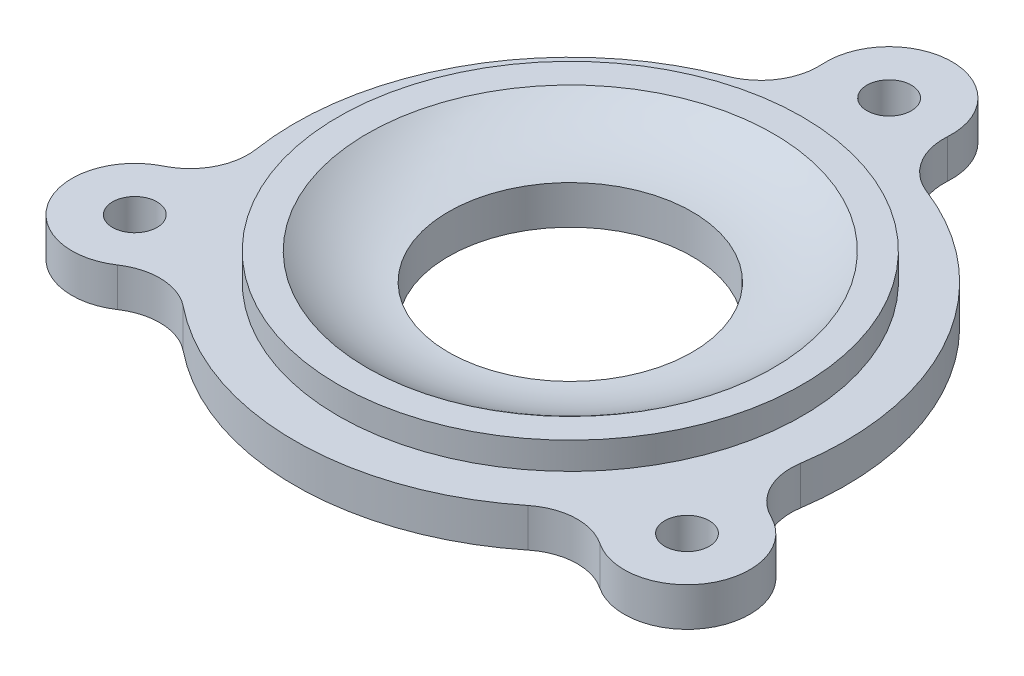
from build123d import *

# Parameters (mm, degrees)
SKETCH_1_R      = 1.15
SKETCH_1_R_2    = 6.3
EXTRUDE_1_DEPTH = 2
SKETCH_2_R      = 12
SKETCH_2_R_2    = 10.5
EXTRUDE_2_DEPTH = 1.4
FILLET_1_R      = 7


with BuildPart() as part:
    # Эскиз1 → Бобышка-Вытянуть1 (new body)
    with BuildSketch(Plane(origin=(0, 0, 0), x_dir=(1, 0, 0), z_dir=(0, 1, 0))):
        with BuildLine():
            ThreePointArc((-5.15088911, 13.27576519), (-12.33220175, 7.12), (-14.072594464, -2.177081774))
            ThreePointArc((-14.072594464, -2.177081774), (-14.376715993, -4.021792929), (-15.714174027, -5.328183054))
            ThreePointArc((-15.714174027, -5.328183054), (-17.095341471, -9.87), (-12.471428894, -10.94478238))
            ThreePointArc((-12.471428894, -10.94478238), (-10.671332842, -10.439704809), (-8.921705354, -11.098683416))
            ThreePointArc((-8.921705354, -11.098683416), (0, -14.24), (8.921705354, -11.098683416))
            ThreePointArc((8.921705354, -11.098683416), (10.671332842, -10.439704809), (12.471428894, -10.94478238))
            ThreePointArc((12.471428894, -10.94478238), (17.095341471, -9.87), (15.714174027, -5.328183054))
            ThreePointArc((15.714174027, -5.328183054), (14.376715993, -4.021792929), (14.072594464, -2.177081774))
            ThreePointArc((14.072594464, -2.177081774), (12.33220175, 7.12), (5.15088911, 13.27576519))
            ThreePointArc((5.15088911, 13.27576519), (3.705383152, 14.461497738), (3.242745133, 16.272965434))
            ThreePointArc((3.242745133, 16.272965434), (0, 19.74), (-3.242745133, 16.272965434))
            ThreePointArc((-3.242745133, 16.272965434), (-3.705383152, 14.461497738), (-5.15088911, 13.27576519))
        make_face()
        with Locations(Location((0, 16.49, 0), (0, 0, 270))):
            Circle(SKETCH_1_R, mode=Mode.SUBTRACT)
        with Locations(Location((0, 0, 0), (0, 0, 270))):
            Circle(SKETCH_1_R_2, mode=Mode.SUBTRACT)
        with Locations(Location((14.280758908, -8.245, 0), (0, 0, 270))):
            Circle(SKETCH_1_R, mode=Mode.SUBTRACT)
        with Locations(Location((-14.280758908, -8.245, 0), (0, 0, 270))):
            Circle(SKETCH_1_R, mode=Mode.SUBTRACT)
    extrude(amount=EXTRUDE_1_DEPTH)

    # Эскиз2 → Бобышка-Вытянуть2 (add)
    with BuildSketch(Plane(origin=(0, 2, 0), x_dir=(1, 0, 0), z_dir=(0, 1, 0))):
        with Locations(Location((0, 0, 0), (0, 0, 270))):
            Circle(SKETCH_2_R)
        with Locations(Location((0, 0, 0), (0, 0, 270))):
            Circle(SKETCH_2_R_2, mode=Mode.SUBTRACT)
    extrude(amount=EXTRUDE_2_DEPTH)

    # Скругление1
    # the kernel refuses this fillet: 7 mm, written as the material it adds along each edge
    with BuildSketch(Plane(origin=(0, 2, 0), x_dir=(0, 0, 1), z_dir=(-1, 0, 0))) as fillet_1_piece_1:
        with BuildLine():
            CenterArc((6.3, 7), FILLET_1_R, 270, 36.869897646)
            Line((10.5, 1.4), (10.5, 0))
            Line((10.5, 0), (6.3, 0))
        make_face()
    revolve(axis=Axis((0, 2, 0), (0, 1, 0)))


solid = part.part
